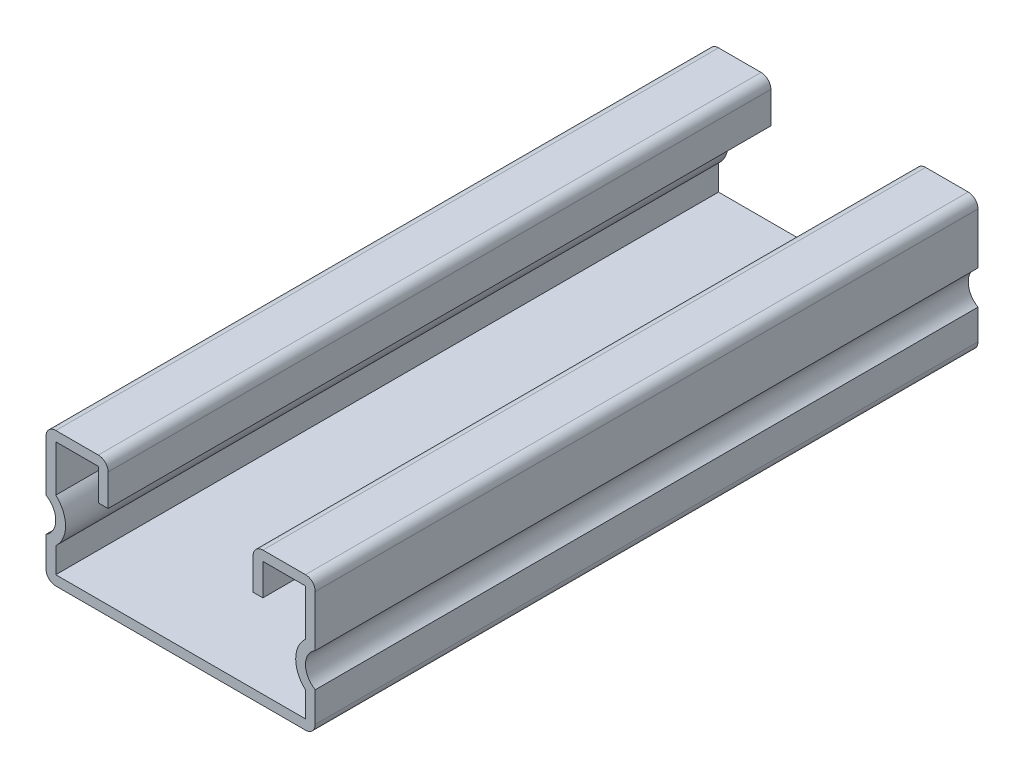
from build123d import *

# Parameters (mm, degrees)
BASE_EXTRUDE_DEPTH = 101.6
HOLE1_START        = -8.7122
HOLE1_OUTLINE_R    = 7.14375
HOLE1_DEPTH        = 1.4986
LPATTERN2_COUNT    = 2
LPATTERN2_PITCH    = 47.625


# Read off the part's stored shape, not the designer's step: Hole1
with BuildPart() as part:
    # Sketch1 → Base-Extrude (new body)
    with BuildSketch(Plane.XY):
        with BuildLine():
            Line((-20.6375, 10.4394), (-20.6375, 2.59565134))
            ThreePointArc((-20.6375, 2.59565134), (-19.1389, 0), (-20.6375, -2.59565134))
            Line((-20.6375, -2.59565134), (-20.6375, -7.2136))
            ThreePointArc((-20.6375, -7.2136), (-20.198570222, -8.273270222), (-19.1389, -8.7122))
            Line((-19.1389, -8.7122), (19.1389, -8.7122))
            ThreePointArc((19.1389, -8.7122), (20.198570222, -8.273270222), (20.6375, -7.2136))
            Line((20.6375, -7.2136), (20.6375, -2.59565134))
            ThreePointArc((20.6375, -2.59565134), (19.1389, 0), (20.6375, 2.59565134))
            Line((20.6375, 2.59565134), (20.6375, 10.4394))
            ThreePointArc((20.6375, 10.4394), (20.198570222, 11.499070222), (19.1389, 11.938))
            Line((19.1389, 11.938), (12.6111, 11.938))
            ThreePointArc((12.6111, 11.938), (11.551429778, 11.499070222), (11.1125, 10.4394))
            Line((11.1125, 10.4394), (11.1125, 5.588))
            Line((11.1125, 5.588), (12.6111, 5.588))
            Line((12.6111, 5.588), (12.6111, 10.4394))
            Line((12.6111, 10.4394), (19.1389, 10.4394))
            Line((19.1389, 10.4394), (19.1389, 3.350971471))
            ThreePointArc((19.1389, 3.350971471), (17.6403, 0), (19.1389, -3.350971471))
            Line((19.1389, -3.350971471), (19.1389, -7.2136))
            Line((19.1389, -7.2136), (-19.1389, -7.2136))
            Line((-19.1389, -7.2136), (-19.1389, -3.350971471))
            ThreePointArc((-19.1389, -3.350971471), (-17.6403, 0), (-19.1389, 3.350971471))
            Line((-19.1389, 3.350971471), (-19.1389, 10.4394))
            Line((-19.1389, 10.4394), (-12.6111, 10.4394))
            Line((-12.6111, 10.4394), (-12.6111, 5.588))
            Line((-12.6111, 5.588), (-11.1125, 5.588))
            Line((-11.1125, 5.588), (-11.1125, 10.4394))
            ThreePointArc((-11.1125, 10.4394), (-11.551429778, 11.499070222), (-12.6111, 11.938))
            Line((-12.6111, 11.938), (-19.1389, 11.938))
            ThreePointArc((-19.1389, 11.938), (-20.198570222, 11.499070222), (-20.6375, 10.4394))
        make_face()
    extrude(amount=BASE_EXTRUDE_DEPTH)

    # Hole1 outline → Hole1 (cut)
    with BuildSketch(Plane(origin=(0, 0, 0), x_dir=(1, 0, 0), z_dir=(0, 1, 0)).offset(HOLE1_START)):
        with Locations((0, -23.8125)):
            Circle(HOLE1_OUTLINE_R)
    hole1 = extrude(amount=HOLE1_DEPTH, mode=Mode.SUBTRACT)

    # LPattern2: Hole1 ×2
    with Locations(*[(0, 0, i * LPATTERN2_PITCH) for i in range(1, LPATTERN2_COUNT)]):
        add(hole1, mode=Mode.SUBTRACT)


solid = part.part
